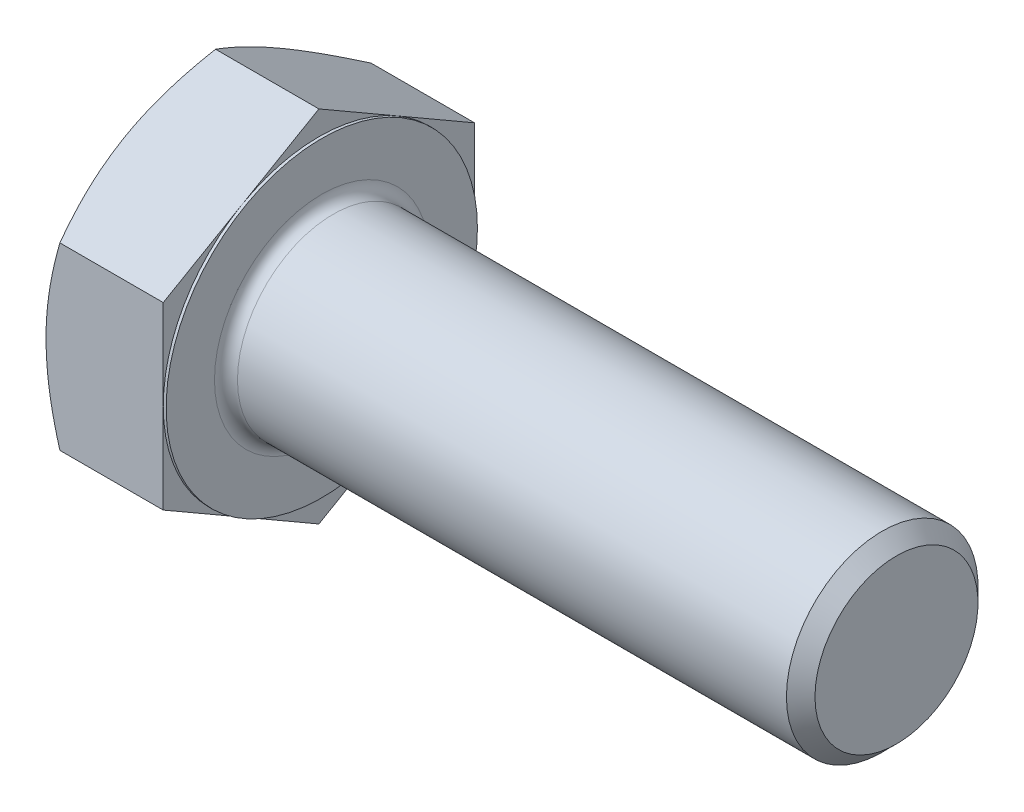
from build123d import *

# Parameters (mm, degrees)
BASEHEAD_DEPTH = 15.9258
SKETCH4_W      = 0.381
SKETCH4_H      = 28.592632361
HEADFILLET_R   = 1.524


with BuildPart() as part:
    # Sketch1 → BaseHead (new body)
    with BuildSketch(Plane(origin=(0, 0, 0), x_dir=(0, 0, -1), z_dir=(1, 0, 0))):
        Polygon((20.6375, 11.91506618), (20.6375, -11.91506618), (0, -23.830132361), (-20.6375, -11.91506618), (-20.6375, 11.91506618), (0, 23.830132361), align=None)
    extrude(amount=BASEHEAD_DEPTH)

    # BodySke → BaseBody (revolve)
    with BuildSketch(Plane.XY):
        Polygon((0, 0), (92.1258, 0), (92.1258, 10.8077), (90.2335, 12.7), (0, 12.7), align=None)
    revolve(axis=Axis((0, 0, 0), (1, 0, 0)))

    # Sketch3 → HeadChamfer (revolve, cut)
    with BuildSketch(Plane.XY):
        Polygon((0, 20.6375), (5.509441362, 30.180132361), (5.509441362, 36.530132361), (-12.7, 36.530132361), (-12.7, 20.6375), align=None)
    revolve(axis=Axis((0, 0, 0), (1, 0, 0)), mode=Mode.SUBTRACT)

    # Sketch4 → BearingFace (revolve, cut)
    with BuildSketch(Plane.XY):
        with Locations((15.7353, 34.933816181)):
            Rectangle(SKETCH4_W, SKETCH4_H)
    revolve(axis=Axis((0, 0, 0), (1, 0, 0)), mode=Mode.SUBTRACT)

    # HeadFillet
    headfillet_edges = [part.edges().sort_by_distance(p)[0] for p in [
        (15.9258, -12.7, 0),
    ]]
    fillet(headfillet_edges, radius=HEADFILLET_R)


solid = part.part
